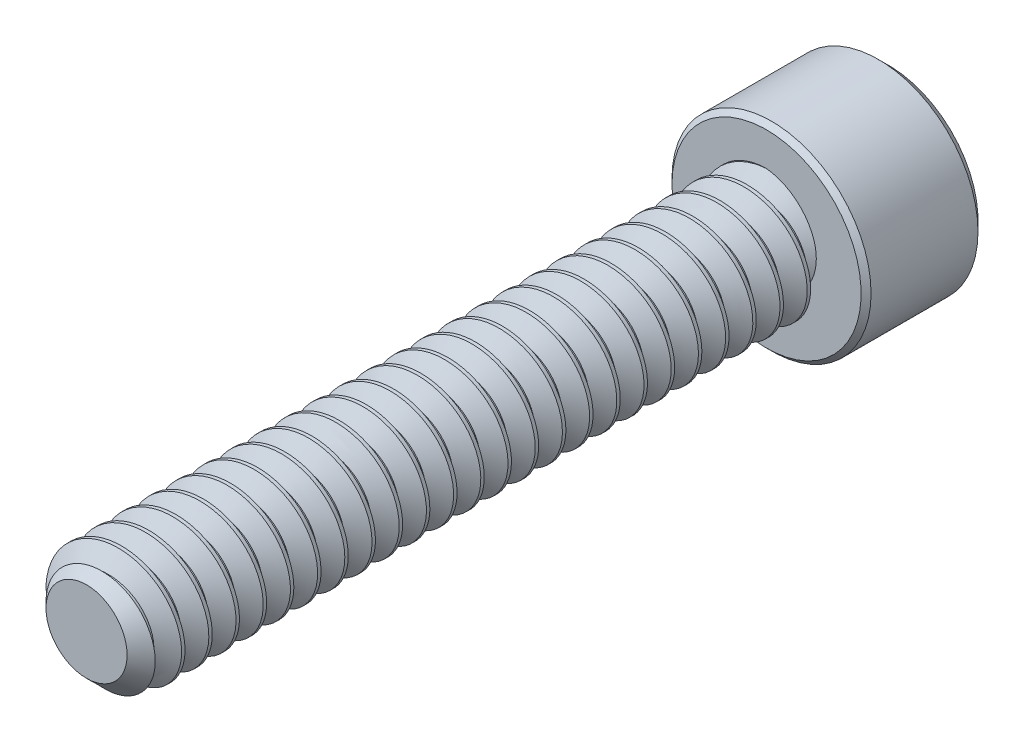
from build123d import *

# Parameters (mm, degrees)
SKETCH1_R          = 1.4224
EXTRUDE1_DEPTH     = 15.875
CHAMFER3_SIZE      = 0.47625
CUT_SWEEP1_PITCH   = 0.635
SKETCH6_R          = 2.3241
EXTRUDE2_DEPTH     = 2.8448
CUT_EXTRUDE1_DEPTH = 1.7859375
CHAMFER1_SIZE      = 0.23241
CHAMFER2_SIZE      = 0.116205


with BuildPart() as part:
    # Sketch1 → Extrude1 (new body)
    with BuildSketch(Plane.XY):
        Circle(SKETCH1_R)
    extrude(amount=-EXTRUDE1_DEPTH)

    # Chamfer3
    chamfer3_edges = [part.edges().sort_by_distance(p)[0] for p in [
        (-1.4224, 0, 0),
    ]]
    chamfer(chamfer3_edges, length=CHAMFER3_SIZE)

    # Cut-Sweep1: the profile of Sketch3 profile screwed along a right-hand helix of 26 turns, 6 arcs to a turn; built about Z, then put on its axis
    cut_sweep1_z = Axis((0, 0, 0), (0, 0, 1))
    cut_sweep1_corners = [(1.4227, 0, -0.555798205), (1.009955401, 0, -0.3175), (1.009955401, 0, -0.238125), (1.4227, 0, 0.000173205)]
    with BuildLine(mode=Mode.PRIVATE) as cut_sweep1_profile:
        Line(cut_sweep1_corners[0], cut_sweep1_corners[1])
        Line(cut_sweep1_corners[1], cut_sweep1_corners[2])
        Line(cut_sweep1_corners[2], cut_sweep1_corners[3])
        Line(cut_sweep1_corners[3], cut_sweep1_corners[0])
    cut_sweep1_cap = Face(cut_sweep1_profile.wire())
    cut_sweep1_turn_angles = [0, 30, 60, 90, 120, 150, 180, 210, 240, 270, 300, 330, 360]
    cut_sweep1_turn_weights = [1, 0.8660254037844387, 1, 0.8660254037844387, 1, 0.8660254037844387, 1, 0.8660254037844387, 1, 0.8660254037844387, 1, 0.8660254037844387, 1]
    cut_sweep1_turn_rails = [Edge.make_bspline([Vector(p[0], p[1], 0).rotate(cut_sweep1_z, cut_sweep1_turn_angles[k]) / cut_sweep1_turn_weights[k] + Vector(0, 0, p[2] + CUT_SWEEP1_PITCH * cut_sweep1_turn_angles[k] / 360) for k in range(13)], [0, 0, 0, 1, 1, 2, 2, 3, 3, 4, 4, 5, 5, 6, 6, 6], 2, cut_sweep1_turn_weights) for p in cut_sweep1_corners]
    cut_sweep1_turn_sides = [Face.make_surface_from_curves(cut_sweep1_turn_rails[p[0]], cut_sweep1_turn_rails[p[1]]) for p in [(0, 1), (1, 2), (2, 3), (3, 0)]]
    cut_sweep1 = Plane(origin=(0, 0, 0), x_dir=(0, 1, 0), z_dir=(0, 0, -1)) * Solid(Shell([*[p.moved(Location((0, 0, CUT_SWEEP1_PITCH * i))) for i in range(26) for p in cut_sweep1_turn_sides], cut_sweep1_cap, cut_sweep1_cap.rotate(cut_sweep1_z, 9360).moved(Location((0, 0, CUT_SWEEP1_PITCH * 9360 / 360)))]))
    add(cut_sweep1, mode=Mode.SUBTRACT)

    # Sketch6 → Extrude2 (add)
    with BuildSketch(Plane(origin=(0, 0, -15.875), x_dir=(-1, 0, 0), z_dir=(0, 0, -1))):
        Circle(SKETCH6_R)
    extrude(amount=EXTRUDE2_DEPTH)

    # Sketch7 → Cut-Extrude1 (cut)
    with BuildSketch(Plane(origin=(0, 0, -18.7198), x_dir=(-1, 0, 0), z_dir=(0, 0, -1))):
        Polygon((0, 1.374815329), (-1.190625, 0.687407664), (-1.190625, -0.687407664), (0, -1.374815329), (1.190625, -0.687407664), (1.190625, 0.687407664), align=None)
    extrude(amount=-CUT_EXTRUDE1_DEPTH, mode=Mode.SUBTRACT)

    # Cut-Extrude2 cone 1 section (through the dimple's axis) → Cut-Extrude2 (revolve, cut)
    with BuildSketch(Plane(origin=(0, 0, -18.7198), x_dir=(0, 1, 0), z_dir=(1, 0, 0))):
        Polygon((0, 0), (1.374815329, 0), (0, 1.374815329), align=None)
    revolve(axis=Axis((0, 0, -18.7198), (0, 0, 1)), mode=Mode.SUBTRACT)

    # Chamfer1
    chamfer1_edges = [part.edges().sort_by_distance(p)[0] for p in [
        (2.3241, 0, -18.7198),
    ]]
    chamfer(chamfer1_edges, length=CHAMFER1_SIZE)

    # Chamfer2
    chamfer2_edges = [part.edges().sort_by_distance(p)[0] for p in [
        (2.3241, 0, -15.875),
    ]]
    chamfer(chamfer2_edges, length=CHAMFER2_SIZE)


solid = part.part
